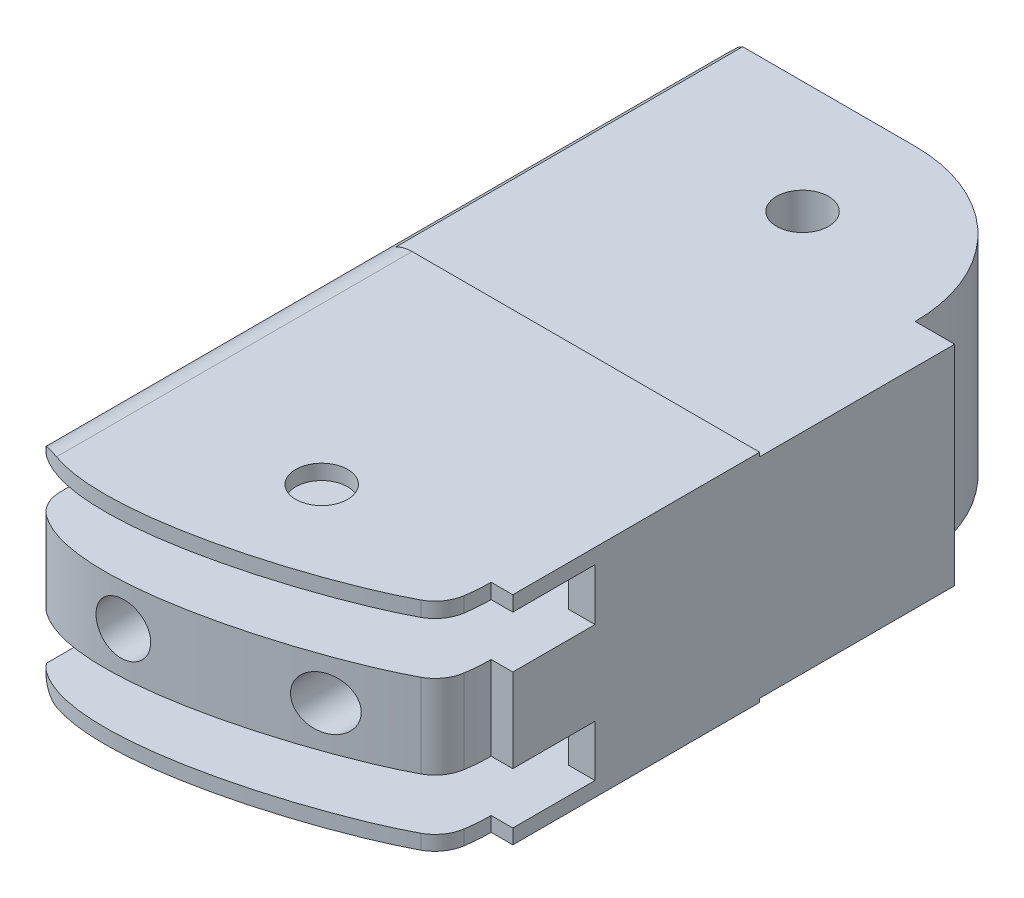
from build123d import *

# Parameters (mm, degrees)
SKETCH1_W               = 22.054431489
SKETCH1_H               = 12.5
BOSS_EXTRUDE1_DEPTH     = 43
CUT_EXTRUDE1_DEPTH      = 10
CUT_EXTRUDE1_DEPTH_BACK = 15
SKETCH2_R               = 1.5
FILLET3_R               = 2
SKETCH5_R               = 1.5
CUT_EXTRUDE4_DEPTH      = 57.460223181
CUT_EXTRUDE6_DEPTH      = 10
CUT_EXTRUDE6_DEPTH_BACK = 8.5
SKETCH16_W              = 22.254981862
SKETCH16_H              = 2.991460448
SKETCH16_H_2            = 2.962476682
FILLET4_R               = 2
SKETCH17_W              = 18.620112401
SKETCH17_H              = 2.962476682
SKETCH17_H_2            = 2.991460448
CUT_EXTRUDE7_DEPTH      = 5
SKETCH18_W              = 23.815970502
SKETCH18_H              = 0.508634756
SKETCH18_W_2            = 23.819185945
SKETCH18_H_2            = 0.668990904
CUT_EXTRUDE8_DEPTH      = 20


with BuildPart() as part:
    # Sketch1 → Boss-Extrude1 (new body)
    with BuildSketch(Plane.XY):
        with Locations((-13.228930986, -24.070183414)):
            Rectangle(SKETCH1_W, SKETCH1_H)
    extrude(amount=BOSS_EXTRUDE1_DEPTH)

    # Sketch2 → Cut-Extrude1 (cut, two sides: drawn at the far end of the back side and taken through both)
    with BuildSketch(Plane.XZ.offset(30.320183414).offset(-CUT_EXTRUDE1_DEPTH_BACK)):
        with Locations(Location((-13.228930986, 6.5, 0), (0, 0, 90))):
            Circle(SKETCH2_R)
        with Locations(Location((-13.228930986, 34.242856315, 0), (0, 0, 90))):
            Circle(SKETCH2_R)
        with BuildLine():
            Line((-3.452400544, 34.242856315), (-2.201715242, 34.242856315))
            add(Edge.make_bspline(
                [(-24.256146731, 33.845079723), (-30.575526658, 43.607362182), (-11.195866971, 55.012360634), (11.473693948, 42.135391331), (-2.201715242, 34.242856315)],
                knots=[0, 0, 0, 0, 0.486113305, 1, 1, 1, 1], degree=3))
            add(Edge.make_bspline(
                [(-3.757837453, 36.667507789), (-8.059315717, 39.510148032), (-28.688217354, 46.070013084), (-24.256146731, 33.845079723)],
                knots=[0, 0, 0, 0, 1, 1, 1, 1], degree=3))
            ThreePointArc((-3.757837453, 36.667507789), (-3.529060324, 35.464763275), (-3.452400544, 34.242856315))
        make_face()
        with BuildLine():
            Line((-4.478930986, 8.75), (-2.201715242, 8.75))
            add(Edge.make_bspline(
                [(-2.201715242, 8.75), (5.39210746, 3.880294823), (-0.777052631, -4.523329032), (-17.174300591, -10.623347238), (-34.821400648, -0.026005424), (-24.256146731, 8.75)],
                knots=[0, 0, 0, 0, 0.283272691, 0.504244858, 1, 1, 1, 1], degree=3))
            add(Edge.make_bspline(
                [(-23.490579314, 0), (-24.966512963, 4.237786421), (-24.256146731, 8.75)],
                knots=[0, 0, 0, 1, 1, 1], degree=2))
            Line((-23.490579314, 0), (-13.228930986, 0))
            ThreePointArc((-13.228930986, 0), (-7.041746651, 2.562815665), (-4.478930986, 8.75))
        make_face()
    extrude(amount=CUT_EXTRUDE1_DEPTH + CUT_EXTRUDE1_DEPTH_BACK, mode=Mode.SUBTRACT)

    # Fillet3
    # the kernel refuses this fillet: 2 mm, written as the material it takes off along each edge
    with BuildSketch(Plane(origin=(-24.256146731, -17.820183414, -5.498495188), x_dir=(1, 0, 0), z_dir=(0, 0, 1))) as fillet3_piece_1:
        with BuildLine():
            CenterArc((FILLET3_R, -FILLET3_R), FILLET3_R, 90, 90)
            Line((0, -FILLET3_R), (-FILLET3_R * 0.02, -FILLET3_R))
            Line((-FILLET3_R * 0.02, -FILLET3_R), (-FILLET3_R * 0.02, FILLET3_R * 0.02))
            Line((-FILLET3_R * 0.02, FILLET3_R * 0.02), (FILLET3_R, FILLET3_R * 0.02))
            Line((FILLET3_R, FILLET3_R * 0.02), (FILLET3_R, 0))
        make_face()
    extrude(amount=49.579952304, mode=Mode.SUBTRACT)
    with BuildSketch(Plane(origin=(-24.256146731, -30.320183414, -5.498495188), x_dir=(1, 0, 0), z_dir=(0, 0, 1))) as fillet3_piece_2:
        with BuildLine():
            CenterArc((FILLET3_R, FILLET3_R), FILLET3_R, 180, 90)
            Line((0, FILLET3_R), (-FILLET3_R * 0.02, FILLET3_R))
            Line((-FILLET3_R * 0.02, FILLET3_R), (-FILLET3_R * 0.02, -FILLET3_R * 0.02))
            Line((-FILLET3_R * 0.02, -FILLET3_R * 0.02), (FILLET3_R, -FILLET3_R * 0.02))
            Line((FILLET3_R, -FILLET3_R * 0.02), (FILLET3_R, 0))
        make_face()
    extrude(amount=49.579952304, mode=Mode.SUBTRACT)
    with BuildSketch(Plane(origin=(-24.256146731, -17.374523396, 3.001504812), x_dir=(0.16676818592575848, -1.2260366807919533e-15, -0.9859961319209278), z_dir=(0, -1, 0))) as fillet3_piece_3:
        with BuildLine():
            CenterArc((0.168096911, 1.999974157), FILLET3_R, 260.400032587, 9.891234523)
            Line((-0.165439461, 0.027981894), (-0.172110188, -0.011457952))
            Line((-0.172110188, -0.011457952), (-0.006670727, -0.039439845))
            Line((-0.006670727, -0.039439845), (-0.00020343, -0.039999483))
            ThreePointArc((-0.00020343, -0.039999483), (0.089132026, -0.040226606), (0.178467349, -0.039999483))
            Line((0.178467349, -0.039999483), (0.178264007, 0))
        make_face()
    extrude(amount=13.391320036, mode=Mode.SUBTRACT)
    with BuildSketch(Plane(origin=(-24.256146731, -14.845669726, 39.081457115), x_dir=(0.7050638771295608, 0, 0.7091438000624637), z_dir=(0, -1, 0))) as fillet3_piece_4:
        with BuildLine():
            CenterArc((0.853663976, -1.971549871), FILLET3_R, 80.324332734, 54.510372083)
            Line((-0.556463778, -0.553262271), (-0.584666333, -0.524896519))
            Line((-0.584666333, -0.524896519), (-0.028202555, 0.028365752))
            Line((-0.028202555, 0.028365752), (-0.007160044, 0.039353955))
            ThreePointArc((-0.007160044, 0.039353955), (0.595170372, 0.092331415), (1.196528305, 0.039430997))
            Line((1.196528305, 0.039430997), (1.189805475, 0))
        make_face()
    extrude(amount=18.449027376, mode=Mode.SUBTRACT)

    # Sketch5 → Cut-Extrude4 (cut, through all)
    with BuildSketch(Plane.XY):
        with Locations(Location((-18.011106811, -24.070183414, 0), (0, 0, 180))):
            Circle(SKETCH5_R)
        with Locations(Location((-8.446755162, -24.070183414, 0), (0, 0, 180))):
            Circle(SKETCH5_R)
    extrude(amount=CUT_EXTRUDE4_DEPTH, mode=Mode.SUBTRACT)

    # Sketch16 → Cut-Extrude6 (cut, two sides: drawn at the far end of the back side and taken through both)
    with BuildSketch(Plane.XY.offset(38).offset(-CUT_EXTRUDE6_DEPTH_BACK)):
        with Locations((-13.23420775, -20.185246876)):
            Rectangle(SKETCH16_W, SKETCH16_H)
        with Locations((-13.23420775, -27.993084265)):
            Rectangle(SKETCH16_W, SKETCH16_H_2)
    extrude(amount=CUT_EXTRUDE6_DEPTH + CUT_EXTRUDE6_DEPTH_BACK, mode=Mode.SUBTRACT)

    # Fillet4
    fillet4_edges = [part.edges().sort_by_distance(p)[0] for p in [
        (-3.757837453, -18.254850033, 36.667507789),
        (-3.757837453, -24.096411512, 36.667507789),
        (-3.757837453, -29.89725301, 36.667507789),
    ]]
    fillet(fillet4_edges, radius=FILLET4_R)

    # Sketch17 → Cut-Extrude7 (cut)
    with BuildSketch(Plane.XY.offset(29.5)):
        with Locations((-13.043692231, -27.993084265)):
            Rectangle(SKETCH17_W, SKETCH17_H)
        with Locations((-13.043692231, -20.185246876)):
            Rectangle(SKETCH17_W, SKETCH17_H_2)
    extrude(amount=-CUT_EXTRUDE7_DEPTH, mode=Mode.SUBTRACT)

    # Sketch18 → Cut-Extrude8 (cut)
    with BuildSketch(Plane.XY):
        with Locations((-13.361747728, -30.370746627)):
            Rectangle(SKETCH18_W, SKETCH18_H)
        with Locations((-13.36335545, -17.714562357)):
            Rectangle(SKETCH18_W_2, SKETCH18_H_2)
    extrude(amount=CUT_EXTRUDE8_DEPTH, mode=Mode.SUBTRACT)


solid = part.part
